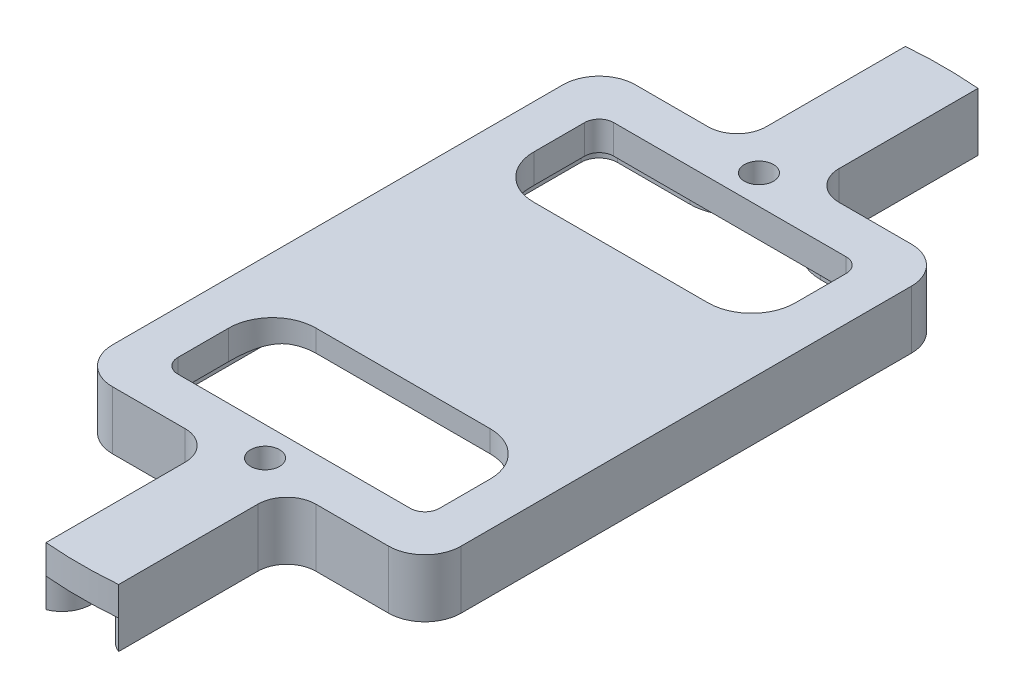
from build123d import *
from build123d.topology import SkipClean

# Parameters (mm, degrees)
BATTERY_HOLDER_OUTLINE_DEPTH        = 2
LIP_START                           = 2
LIP_DEPTH                           = 2
SKETCH4_R                           = 1
SCREWHOLE_DEPTH                     = 10
SKETCH5_W                           = 18
SKETCH5_H                           = 15
ACTUAL_BATTERY_CAP_THINGY_DEPTH     = 1.5
FILLETS_START                       = 91.999999219
FILLETS_FOR_THE_THING_ABOVE_DEPTH   = 2.000000781
FILLETS_START_2                     = -12
FILLETS_FOR_THE_THING_ABOVE_2_DEPTH = 23
FILLETS_AT_EDGE_R                   = 2


with BuildPart() as part:
    # Sketch2 → Battery holder outline (new body)
    with BuildSketch(Plane(origin=(0, 92, 0), x_dir=(1, 0, 0), z_dir=(0, 1, 0))):
        with BuildLine():
            Line((-9.5, -18), (-4.5, -18))
            ThreePointArc((-4.5, -18), (-3.085786438, -18.585786438), (-2.5, -20))
            Line((-2.5, -20), (-2.5, -29.579540649))
            ThreePointArc((-2.5, -29.579540649), (0, -29.685), (2.5, -29.579540649))
            Line((2.5, -29.579540649), (2.5, -20))
            ThreePointArc((2.5, -20), (3.085786438, -18.585786438), (4.5, -18))
            Line((4.5, -18), (9.5, -18))
            ThreePointArc((9.5, -18), (11.267766953, -17.267766953), (12, -15.5))
            Line((12, -15.5), (12, 15.5))
            ThreePointArc((12, 15.5), (11.267766953, 17.267766953), (9.5, 18))
            Line((9.5, 18), (4.5, 18))
            ThreePointArc((4.5, 18), (3.085786438, 18.585786438), (2.5, 20))
            Line((2.5, 20), (2.5, 29.579540649))
            ThreePointArc((2.5, 29.579540649), (0, 29.685), (-2.5, 29.579540649))
            Line((-2.5, 29.579540649), (-2.5, 20))
            ThreePointArc((-2.5, 20), (-3.085786438, 18.585786438), (-4.5, 18))
            Line((-4.5, 18), (-9.5, 18))
            ThreePointArc((-9.5, 18), (-11.267766953, 17.267766953), (-12, 15.5))
            Line((-12, 15.5), (-12, -15.5))
            ThreePointArc((-12, -15.5), (-11.267766953, -17.267766953), (-9.5, -18))
        make_face()
        with BuildLine():
            Line((8, 15), (-8, 15))
            ThreePointArc((-8, 15), (-8.707106781, 14.707106781), (-9, 14))
            Line((-9, 14), (-9, -14))
            ThreePointArc((-9, -14), (-8.707106781, -14.707106781), (-8, -15))
            Line((-8, -15), (8, -15))
            ThreePointArc((8, -15), (8.707106781, -14.707106781), (9, -14))
            Line((9, -14), (9, 14))
            ThreePointArc((9, 14), (8.707106781, 14.707106781), (8, 15))
        make_face(mode=Mode.SUBTRACT)
    extrude(amount=BATTERY_HOLDER_OUTLINE_DEPTH)

    # Sketch3 → Lip (add)
    with SkipClean():  # the faces are left unmerged after this step: merging them gives an invalid solid
        with BuildSketch(Plane.XZ.offset(-92).offset(LIP_START)):
            with BuildLine():
                Line((2.5, 20), (2.5, 29.579540649))
                ThreePointArc((2.5, 29.579540649), (1.875417387, 29.625698888), (1.25, 29.658670317))
                Line((1.25, 29.658670317), (1.25, 28.407511771))
                Line((1.25, 28.407511771), (1.25, 20))
                ThreePointArc((1.25, 20), (2.201902961, 17.701902961), (4.5, 16.75))
                Line((4.5, 16.75), (9.5, 16.75))
                ThreePointArc((9.5, 16.75), (10.383883476, 16.383883476), (10.75, 15.5))
                Line((10.75, 15.5), (10.75, -15.5))
                ThreePointArc((10.75, -15.5), (10.383883476, -16.383883476), (9.5, -16.75))
                Line((9.5, -16.75), (4.5, -16.75))
                ThreePointArc((4.5, -16.75), (2.201902961, -17.701902961), (1.25, -20))
                Line((1.25, -20), (1.25, -28.407511771))
                Line((1.25, -28.407511771), (1.25, -29.658670317))
                ThreePointArc((1.25, -29.658670317), (1.875417387, -29.625698888), (2.5, -29.579540649))
                Line((2.5, -29.579540649), (2.5, -20))
                ThreePointArc((2.5, -20), (3.085786438, -18.585786438), (4.5, -18))
                Line((4.5, -18), (9.5, -18))
                ThreePointArc((9.5, -18), (11.267766953, -17.267766953), (12, -15.5))
                Line((12, -15.5), (12, 15.5))
                ThreePointArc((12, 15.5), (11.267766953, 17.267766953), (9.5, 18))
                Line((9.5, 18), (4.5, 18))
                ThreePointArc((4.5, 18), (3.085786438, 18.585786438), (2.5, 20))
            make_face()
            with BuildLine():
                Line((-2.5, -20), (-2.5, -29.579540649))
                ThreePointArc((-2.5, -29.579540649), (-1.875417387, -29.625698888), (-1.25, -29.658670317))
                Line((-1.25, -29.658670317), (-1.25, -28.407511771))
                Line((-1.25, -28.407511771), (-1.25, -20))
                ThreePointArc((-1.25, -20), (-2.201902961, -17.701902961), (-4.5, -16.75))
                Line((-4.5, -16.75), (-9.5, -16.75))
                ThreePointArc((-9.5, -16.75), (-10.383883476, -16.383883476), (-10.75, -15.5))
                Line((-10.75, -15.5), (-10.75, 15.5))
                ThreePointArc((-10.75, 15.5), (-10.383883476, 16.383883476), (-9.5, 16.75))
                Line((-9.5, 16.75), (-4.5, 16.75))
                ThreePointArc((-4.5, 16.75), (-2.201902961, 17.701902961), (-1.25, 20))
                Line((-1.25, 20), (-1.25, 28.407511771))
                Line((-1.25, 28.407511771), (-1.25, 29.658670317))
                ThreePointArc((-1.25, 29.658670317), (-1.875417387, 29.625698888), (-2.5, 29.579540649))
                Line((-2.5, 29.579540649), (-2.5, 20))
                ThreePointArc((-2.5, 20), (-3.085786438, 18.585786438), (-4.5, 18))
                Line((-4.5, 18), (-9.5, 18))
                ThreePointArc((-9.5, 18), (-11.267766953, 17.267766953), (-12, 15.5))
                Line((-12, 15.5), (-12, -15.5))
                ThreePointArc((-12, -15.5), (-11.267766953, -17.267766953), (-9.5, -18))
                Line((-9.5, -18), (-4.5, -18))
                ThreePointArc((-4.5, -18), (-3.085786438, -18.585786438), (-2.5, -20))
            make_face()
        extrude(amount=-LIP_DEPTH)

    # Sketch4 → Screwhole (cut)
    with SkipClean():  # the faces are left unmerged after this step: merging them gives an invalid solid
        with BuildSketch(Plane(origin=(0, 94, 0), x_dir=(1, 0, 0), z_dir=(0, 1, 0))):
            with Locations(Location((0, 17, 0), (0, 0, 270))):
                Circle(SKETCH4_R)
            with Locations(Location((0, -17, 0), (0, 0, 270))):
                Circle(SKETCH4_R)
        extrude(amount=-SCREWHOLE_DEPTH, mode=Mode.SUBTRACT)

    # Sketch5 → Actual battery cap thingy (add)
    with SkipClean():  # the faces are left unmerged after this step: merging them gives an invalid solid
        with BuildSketch(Plane(origin=(0, 94, 0), x_dir=(1, 0, 0), z_dir=(0, 1, 0))):
            Rectangle(SKETCH5_W, SKETCH5_H)
        extrude(amount=-ACTUAL_BATTERY_CAP_THINGY_DEPTH)

    # Fillets for the thing above: read off the stored shape, not the designer's step
    # Fillets for the thing above outline → Fillets for the thing above (add)
    with SkipClean():  # the faces are left unmerged after this step: merging them gives an invalid solid
        with BuildSketch(Plane(origin=(0, 0, 0), x_dir=(1, 0, 0), z_dir=(0, 1, 0)).offset(FILLETS_START)):
            with BuildLine():
                ThreePointArc((9, 10.5), (8.121320344, 8.378679656), (6, 7.5))
                Line((6, 7.5), (-6, 7.5))
                ThreePointArc((-6, 7.5), (-8.121320344, 8.378679656), (-9, 10.5))
                Line((-9, 10.5), (-9, -10.5))
                ThreePointArc((-9, -10.5), (-8.121320344, -8.378679656), (-6, -7.5))
                Line((-6, -7.5), (6, -7.5))
                ThreePointArc((6, -7.5), (8.121320344, -8.378679656), (9, -10.5))
                Line((9, -10.5), (9, 10.5))
            make_face()
        extrude(amount=FILLETS_FOR_THE_THING_ABOVE_DEPTH)

    # Fillets for the thing above 2 outline → Fillets for the thing above 2 (cut)
    with SkipClean():  # the faces are left unmerged after this step: merging them gives an invalid solid
        with BuildSketch(Plane.XY.offset(FILLETS_START_2)):
            with BuildLine():
                ThreePointArc((9.000010237, 91.99999321), (8.207718889, 92.37227955), (7.341687605, 92.5))
                Line((7.341687605, 92.5), (-7.341687605, 92.5))
                ThreePointArc((-7.341687605, 92.5), (-8.207718889, 92.37227955), (-9.000010237, 91.99999321))
                Line((-9.000010237, 91.99999321), (9.000010237, 91.99999321))
            make_face()
        extrude(amount=FILLETS_FOR_THE_THING_ABOVE_2_DEPTH, mode=Mode.SUBTRACT)

    # Fillets at edge
    # the kernel refuses this fillet: 2 mm, written as the material it takes off along each edge
    with BuildSketch(Plane(origin=(-1.25, 85.167051774, -29.658670317), x_dir=(-0.9980023206455083, 0, 0.06317727428577244), z_dir=(0, 1, 0)), Plane(origin=(1.25, 85.167051774, 29.658670317), x_dir=(0.9980023206455083, 0, -0.06317727428577508), z_dir=(0, 1, 0))) as fillets_at_edge_piece_1:
        with BuildLine():
            CenterArc((2.11813764, 1.802962869), FILLETS_AT_EDGE_R, 176.377796501, 67.975687163)
            Line((0.122132998, 1.929317418), (0, 0))
            ThreePointArc((0, 0), (0.626251049, -0.006606603), (1.252502098, 0))
        make_face()
    extrude(amount=6.832948226, mode=Mode.SUBTRACT)
    with BuildSketch(Plane(origin=(1.25, 85.167051774, -29.658670317), x_dir=(0.998002320645508, 0, 0.06317727428577799), z_dir=(0, 1, 0)), Plane(origin=(-1.25, 85.167051774, 29.658670317), x_dir=(-0.998002320645508, 0, -0.06317727428577828), z_dir=(0, 1, 0))) as fillets_at_edge_piece_2:
        with BuildLine():
            CenterArc((2.11813764, -1.802962869), FILLETS_AT_EDGE_R, 115.646516337, 67.975687163)
            Line((0.122132998, -1.929317418), (0, 0))
            ThreePointArc((0, 0), (0.626251049, 0.006606603), (1.252502098, 0))
        make_face()
    extrude(amount=6.832948226, mode=Mode.SUBTRACT)


solid = part.part
